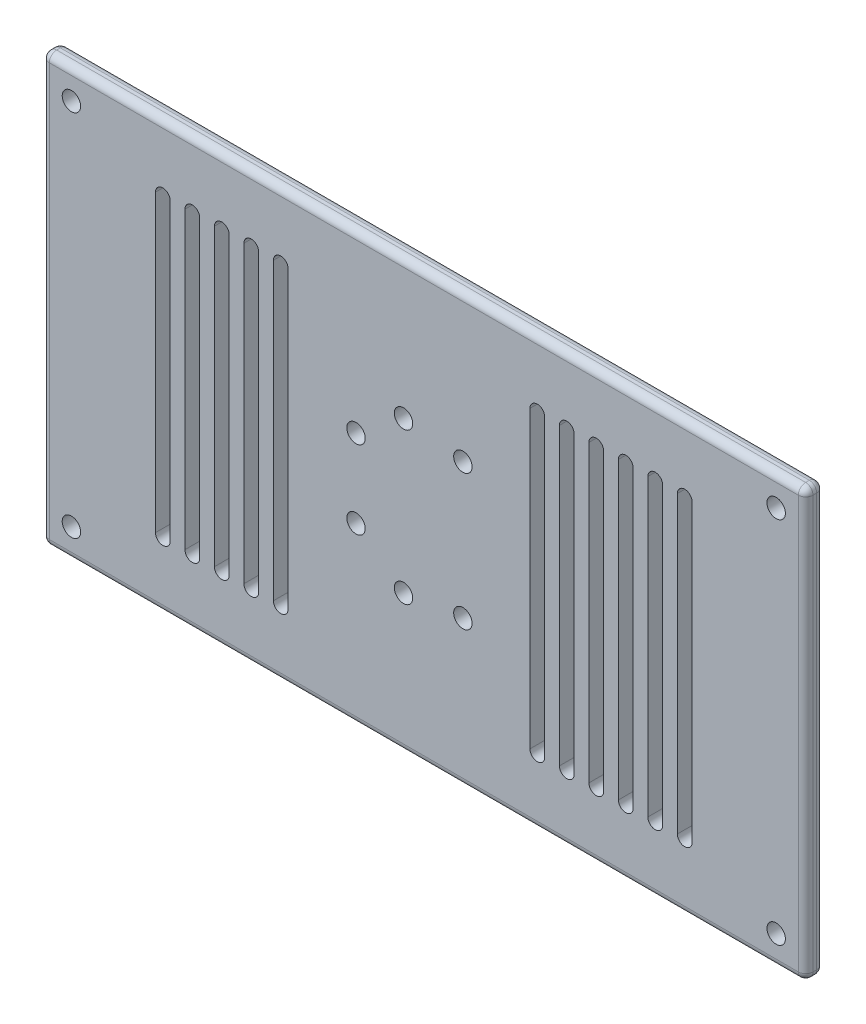
from build123d import *

# Parameters (mm, degrees)
ESQUISSE1_W                                   = 103.6
ESQUISSE1_H                                   = 58
BOSS_EXTRU_1_DEPTH                            = 2.5
CONG_3_R                                      = 1
ESQUISSE32_R                                  = 3
BOSS_EXTRU_8_DEPTH                            = 6.5
ESQUISSE26_R                                  = 3
BOSS_EXTRU_10_DEPTH                           = 6.5
ESQUISSE17_R                                  = 3
BOSS_EXTRU_7_DEPTH                            = 6.5
TROU_POUR_TARAUDAGE_POUR_TROU_TARAUD_M3_D     = 2.5
TROU_POUR_TARAUDAGE_POUR_TROU_TARAUD_M3_DEPTH = 5
TROU_POUR_TARAUDAGE_POUR_TROU_TARAUD_M3_TIP   = 0.751075774
TROU_POUR_TARAUDAGE_POUR_TROU_TARAUD_2_D      = 2.5
TROU_POUR_TARAUDAGE_POUR_TROU_TARAUD_2_DEPTH  = 5
TROU_POUR_TARAUDAGE_POUR_TROU_TARAUD_2_TIP    = 0.751075774
TROU_POUR_TARAUDAGE_POUR_TROU_TARAUD_3_D      = 2.5
TROU_POUR_TARAUDAGE_POUR_TROU_TARAUD_3_DEPTH  = 5
TROU_POUR_TARAUDAGE_POUR_TROU_TARAUD_3_TIP    = 0.751075774
CONG_5_R                                      = 0.5
TROU_POUR_TARAUDAGE_POUR_TROU_TARAUD_4_D      = 2.5
TROU_POUR_TARAUDAGE_POUR_TROU_TARAUD_4_DEPTH  = 5
TROU_POUR_TARAUDAGE_POUR_TROU_TARAUD_4_TIP    = 0.751075774
ENL_V_MAT_EXTRU_2_DEPTH                       = 60.72009712
R_P_TITION_LIN_AIRE1_COUNT                    = 6
R_P_TITION_LIN_AIRE1_PITCH                    = 4
ENL_V_MAT_EXTRU_3_DEPTH                       = 60.72009712
R_P_TITION_LIN_AIRE2_COUNT                    = 5
R_P_TITION_LIN_AIRE2_PITCH                    = 4


with BuildPart() as part:
    # Esquisse1 → Boss.-Extru.1 (new body)
    with BuildSketch(Plane.XY):
        Rectangle(ESQUISSE1_W, ESQUISSE1_H)
    extrude(amount=BOSS_EXTRU_1_DEPTH)

    # Congé3
    cong_3_edges = [part.edges().sort_by_distance(p)[0] for p in [
        (-51.8, 0, 2.5),
        (0, -29, 2.5),
        (0, 29, 2.5),
        (51.8, 0, 2.5),
        (51.8, -29, 1.25),
        (51.8, 29, 1.25),
        (-51.8, 29, 1.25),
        (-51.8, -29, 1.25),
        (51.8, 0, 0),
        (0, 29, 0),
        (-51.8, 0, 0),
        (0, -29, 0),
    ]]
    fillet(cong_3_edges, radius=CONG_3_R)

    # Esquisse32 → Boss.-Extru.8 (add)
    with BuildSketch(Plane.XY.offset(2.5)):
        with Locations((5.303300859, 9.192388155)):
            Circle(ESQUISSE32_R)
        with Locations((-9.192388155, -5.303300859)):
            Circle(ESQUISSE32_R)
    extrude(amount=-BOSS_EXTRU_8_DEPTH)

    # Esquisse26 → Boss.-Extru.10 (add)
    with BuildSketch(Plane.XY.offset(2.5)):
        with Locations((-9.192388155, 5.303300859)):
            Circle(ESQUISSE26_R)
        with Locations((5.303300859, -9.192388155)):
            Circle(ESQUISSE26_R)
    extrude(amount=-BOSS_EXTRU_10_DEPTH)

    # Esquisse17 → Boss.-Extru.7 (add)
    with BuildSketch(Plane.XY.offset(2.5)):
        with Locations((-2.75, 10.25)):
            Circle(ESQUISSE17_R)
        with Locations((-2.75, -10.25)):
            Circle(ESQUISSE17_R)
    extrude(amount=-BOSS_EXTRU_7_DEPTH)

    # Trou pour taraudage pour trou taraud_ M3
    with Locations(Plane(origin=(-2.75, -10.25, 2.5), x_dir=(1, 0, 0), z_dir=(0, 0, 1))):
        with Locations((0, 0), (0, 20.5)):
            Hole(TROU_POUR_TARAUDAGE_POUR_TROU_TARAUD_M3_D / 2, depth=TROU_POUR_TARAUDAGE_POUR_TROU_TARAUD_M3_DEPTH)
            with Locations((0, 0, -(TROU_POUR_TARAUDAGE_POUR_TROU_TARAUD_M3_DEPTH + TROU_POUR_TARAUDAGE_POUR_TROU_TARAUD_M3_TIP / 2))):  # 118° drill point
                Cone(0, TROU_POUR_TARAUDAGE_POUR_TROU_TARAUD_M3_D / 2, TROU_POUR_TARAUDAGE_POUR_TROU_TARAUD_M3_TIP, mode=Mode.SUBTRACT)

    # Trou pour taraudage pour trou taraud 2
    with Locations(Plane(origin=(-9.192388155, 5.303300859, 2.5), x_dir=(1, 0, 0), z_dir=(0, 0, 1))):
        with Locations((0, 0), (14.495689014, -14.495689014)):
            Hole(TROU_POUR_TARAUDAGE_POUR_TROU_TARAUD_2_D / 2, depth=TROU_POUR_TARAUDAGE_POUR_TROU_TARAUD_2_DEPTH)
            with Locations((0, 0, -(TROU_POUR_TARAUDAGE_POUR_TROU_TARAUD_2_DEPTH + TROU_POUR_TARAUDAGE_POUR_TROU_TARAUD_2_TIP / 2))):  # 118° drill point
                Cone(0, TROU_POUR_TARAUDAGE_POUR_TROU_TARAUD_2_D / 2, TROU_POUR_TARAUDAGE_POUR_TROU_TARAUD_2_TIP, mode=Mode.SUBTRACT)

    # Trou pour taraudage pour trou taraud 3
    with Locations(Plane(origin=(5.303300859, 9.192388155, 2.5), x_dir=(1, 0, 0), z_dir=(0, 0, 1))):
        with Locations((0, 0), (-14.495689014, -14.495689014)):
            Hole(TROU_POUR_TARAUDAGE_POUR_TROU_TARAUD_3_D / 2, depth=TROU_POUR_TARAUDAGE_POUR_TROU_TARAUD_3_DEPTH)
            with Locations((0, 0, -(TROU_POUR_TARAUDAGE_POUR_TROU_TARAUD_3_DEPTH + TROU_POUR_TARAUDAGE_POUR_TROU_TARAUD_3_TIP / 2))):  # 118° drill point
                Cone(0, TROU_POUR_TARAUDAGE_POUR_TROU_TARAUD_3_D / 2, TROU_POUR_TARAUDAGE_POUR_TROU_TARAUD_3_TIP, mode=Mode.SUBTRACT)

    # Congé5
    cong_5_edges = [part.edges().sort_by_distance(p)[0] for p in [
        (2.303300859, -9.192388155, -4),
        (-5.75, -10.25, -4),
        (-12.192388155, -5.303300859, -4),
        (-12.192388155, 5.303300859, -4),
        (2.303300859, 9.192388155, -4),
        (-5.75, 10.25, -4),
        (2.303300859, 9.192388155, 0),
        (-5.75, 10.25, 0),
        (-12.192388155, 5.303300859, 0),
        (-12.192388155, -5.303300859, 0),
        (-5.75, -10.25, 0),
        (2.303300859, -9.192388155, 0),
    ]]
    fillet(cong_5_edges, radius=CONG_5_R)

    # Trou pour taraudage pour trou taraud 4
    with Locations(Plane(origin=(47.8, 25, 2.5), x_dir=(1, 0, 0), z_dir=(0, 0, 1))):
        with Locations((0, 0), (0, -50), (-95.6, -50), (-95.6, 0)):
            Hole(TROU_POUR_TARAUDAGE_POUR_TROU_TARAUD_4_D / 2, depth=TROU_POUR_TARAUDAGE_POUR_TROU_TARAUD_4_DEPTH)
            with Locations((0, 0, -(TROU_POUR_TARAUDAGE_POUR_TROU_TARAUD_4_DEPTH + TROU_POUR_TARAUDAGE_POUR_TROU_TARAUD_4_TIP / 2))):  # 118° drill point
                Cone(0, TROU_POUR_TARAUDAGE_POUR_TROU_TARAUD_4_D / 2, TROU_POUR_TARAUDAGE_POUR_TROU_TARAUD_4_TIP, mode=Mode.SUBTRACT)

    # Esquisse36 → Enlèv. mat.-Extru.2 (cut, through all)
    with BuildSketch(Plane.XY.offset(2.5)):
        with BuildLine():
            Line((36.4, 20), (36.4, -20))
            ThreePointArc((36.4, -20), (35.4, -21), (34.4, -20))
            Line((34.4, -20), (34.4, 20))
            ThreePointArc((34.4, 20), (35.4, 21), (36.4, 20))
        make_face()
    enl_v_mat_extru_2 = extrude(amount=-ENL_V_MAT_EXTRU_2_DEPTH, mode=Mode.SUBTRACT)

    # Répétition linéaire1: Enlèv. mat.-Extru.2 ×6
    with Locations(*[(-i * R_P_TITION_LIN_AIRE1_PITCH, 0, 0) for i in range(1, R_P_TITION_LIN_AIRE1_COUNT)]):
        add(enl_v_mat_extru_2, mode=Mode.SUBTRACT)

    # Esquisse37 → Enlèv. mat.-Extru.3 (cut, through all)
    with BuildSketch(Plane.XY.offset(2.5)):
        with BuildLine():
            Line((-34.4, 20), (-34.4, -20))
            ThreePointArc((-34.4, -20), (-35.4, -21), (-36.4, -20))
            Line((-36.4, -20), (-36.4, 20))
            ThreePointArc((-36.4, 20), (-35.4, 21), (-34.4, 20))
        make_face()
    enl_v_mat_extru_3 = extrude(amount=-ENL_V_MAT_EXTRU_3_DEPTH, mode=Mode.SUBTRACT)

    # Répétition linéaire2: Enlèv. mat.-Extru.3 ×5
    with Locations(*[(i * R_P_TITION_LIN_AIRE2_PITCH, 0, 0) for i in range(1, R_P_TITION_LIN_AIRE2_COUNT)]):
        add(enl_v_mat_extru_3, mode=Mode.SUBTRACT)


solid = part.part
